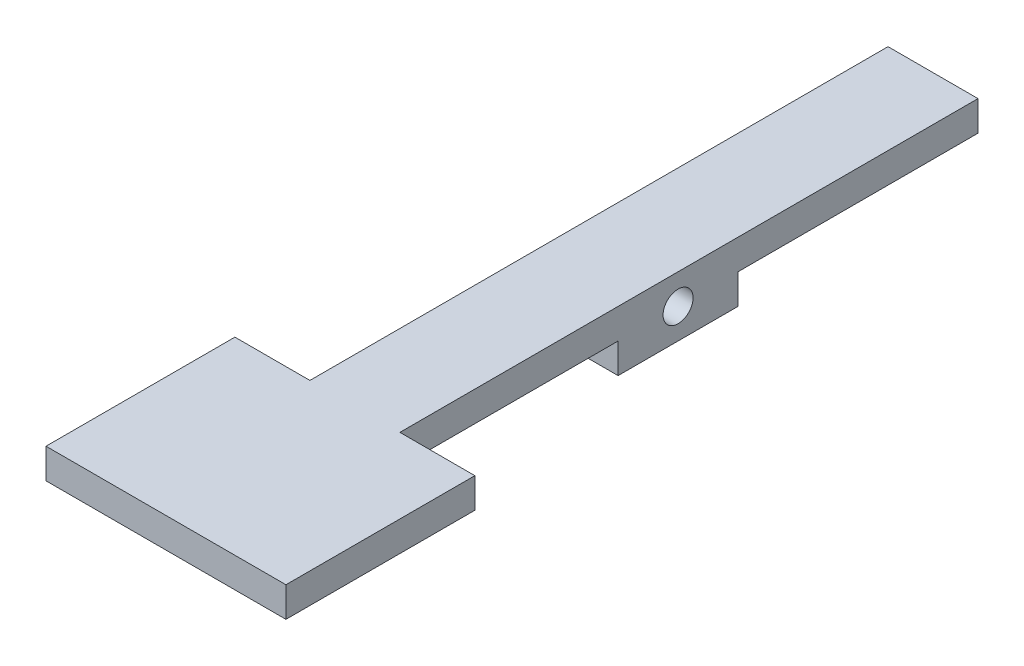
from build123d import *

# Parameters (mm, degrees)
SKETCH1_R           = 1.5875
BOSS_EXTRUDE1_DEPTH = 9.525
SKETCH3_W           = 20
SKETCH3_H           = 3.175
BOSS_EXTRUDE2_DEPTH = 12.7


with BuildPart() as part:
    # Sketch1 → Boss-Extrude1 (new body)
    with BuildSketch(Plane(origin=(0, 0, 0), x_dir=(0, 0, -1), z_dir=(1, 0, 0))):
        Polygon((0, -1.5875), (0, 1.5875), (-76.2, 1.5875), (-76.2, -1.5875), (-38.1, -1.5875), (-38.1, -4.7625), (-25.4, -4.7625), (-25.4, -1.5875), align=None)
        with Locations((-31.75, -1.5875)):
            Circle(SKETCH1_R, mode=Mode.SUBTRACT)
    extrude(amount=BOSS_EXTRUDE1_DEPTH)

    # Sketch3 → Boss-Extrude2 (add, symmetric)
    with BuildSketch(Plane(origin=(4.7625, 0, 0), x_dir=(0, 0, -1), z_dir=(1, 0, 0))):
        with Locations((-71.2, 0)):
            Rectangle(SKETCH3_W, SKETCH3_H)
    extrude(amount=BOSS_EXTRUDE2_DEPTH, both=True)


solid = part.part
